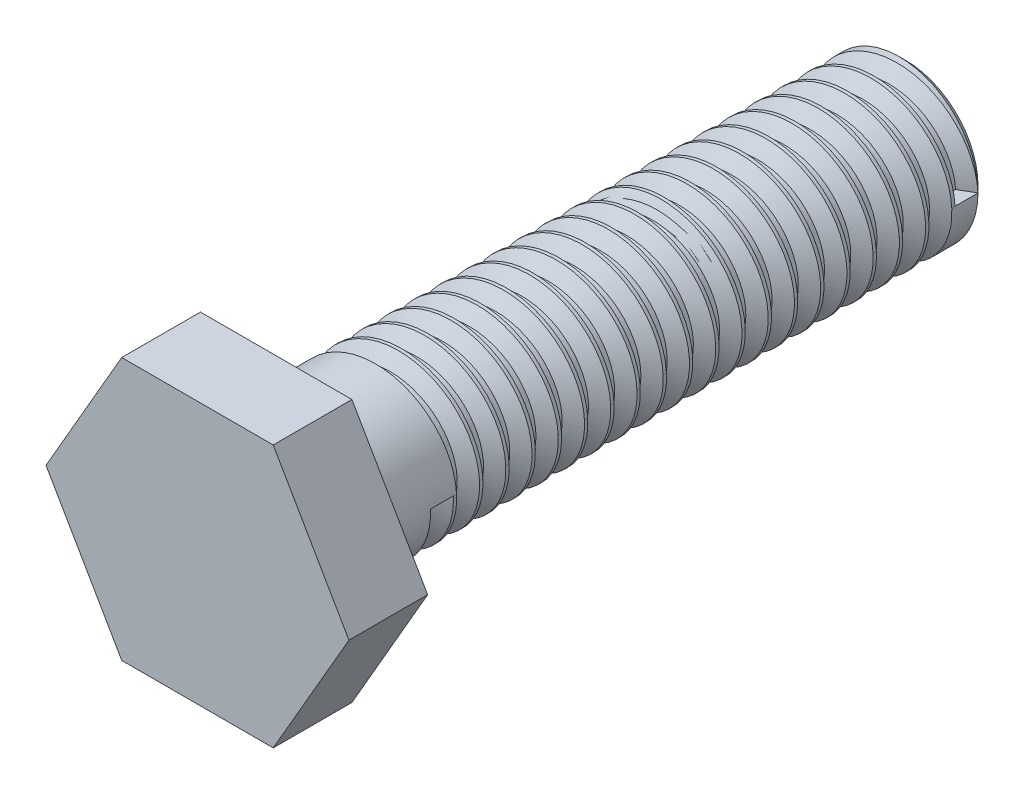
from build123d import *
from build123d.topology import SkipClean

# Parameters (mm, degrees)
EXTRUSION1_DEPTH = 5.8
SKETCH2_R        = 3
EXTRUSION2_DEPTH = 4
EXTRUSION4_DEPTH = 10
SKETCH4_R        = 3
THREAD2_DEPTH    = 20
CHAMFER2_SIZE    = 0.25
EXTRUSION6_DEPTH = 2.8
THREAD3_PITCH    = 1


with BuildPart() as part:
    # Sketch1 → Extrusion1 (new body)
    with BuildSketch(Plane.XY):
        Polygon((6.92820323, -4), (4.618802154, -8), (0, -8), (-4.618802154, -8), (-6.92820323, -4), (-9.237604307, 0), (-6.92820323, 4), (-4.618802154, 8), (0, 8), (4.618802154, 8), (6.92820323, 4), (9.237604307, 0), align=None)
    extrude(amount=-EXTRUSION1_DEPTH)

    # Sketch2 → Extrusion2 (add)
    with BuildSketch(Plane(origin=(0, 0, -5.8), x_dir=(-1, 0, 0), z_dir=(0, 0, -1))):
        Circle(SKETCH2_R)
    extrude(amount=EXTRUSION2_DEPTH)

    # Sketch3 → Extrusion4 (cut)
    with BuildSketch(Plane.XY):
        Polygon((-4.618802154, -8), (4.618802154, -8), (9.237604307, 0), (4.618802154, 8), (-4.618802154, 8), (-9.237604307, 0), align=None)
        Polygon((-2.886751346, 5), (2.886751346, 5), (5.773502692, 0), (2.886751346, -5), (-2.886751346, -5), (-5.773502692, 0), align=None, mode=Mode.SUBTRACT)
    extrude(amount=-EXTRUSION4_DEPTH, mode=Mode.SUBTRACT)

    # Sketch4 → Thread2 (add)
    with BuildSketch(Plane(origin=(0, 0, -9.8), x_dir=(-1, 0, 0), z_dir=(0, 0, -1))):
        Circle(SKETCH4_R)
    extrude(amount=THREAD2_DEPTH)

    # Chamfer2
    chamfer2_edges = [part.edges().sort_by_distance(p)[0] for p in [
        (3, 0, -29.8),
    ]]
    chamfer(chamfer2_edges, length=CHAMFER2_SIZE)

    # Sketch5 → Extrusion6 (cut)
    with BuildSketch(Plane.XY):
        Polygon((5.773502692, 0), (2.886751346, 5), (-2.886751346, 5), (-5.773502692, 0), (-2.886751346, -5), (2.886751346, -5), align=None)
    extrude(amount=-EXTRUSION6_DEPTH, mode=Mode.SUBTRACT)

    # Thread3: the profile of Thread Profile1 profile screwed along a right-hand helix of 20 turns, 8 arcs to a turn; built about Z, then put on its axis
    with SkipClean():  # the faces are left unmerged after this step: merging them gives an invalid solid
        thread3_z = Axis((0, 0, 0), (0, 0, 1))
        thread3_corners = [(3.0003, 0, -0.000173205), (3.0003, 0, 0.875173202), (2.458734125, 0, 0.562499999), (2.458734125, 0, 0.312499999)]
        with BuildLine(mode=Mode.PRIVATE) as thread3_profile:
            Line(thread3_corners[0], thread3_corners[1])
            Line(thread3_corners[1], thread3_corners[2])
            Line(thread3_corners[2], thread3_corners[3])
            Line(thread3_corners[3], thread3_corners[0])
        thread3_cap = Face(thread3_profile.wire())
        thread3_turn_angles = [0, 22.5, 45, 67.5, 90, 112.5, 135, 157.5, 180, 202.5, 225, 247.5, 270, 292.5, 315, 337.5, 360]
        thread3_turn_weights = [1, 0.9238795325112867, 1, 0.9238795325112867, 1, 0.9238795325112867, 1, 0.9238795325112867, 1, 0.9238795325112867, 1, 0.9238795325112867, 1, 0.9238795325112867, 1, 0.9238795325112867, 1]
        thread3_turn_rails = [Edge.make_bspline([Vector(p[0], p[1], 0).rotate(thread3_z, thread3_turn_angles[k]) / thread3_turn_weights[k] + Vector(0, 0, p[2] + THREAD3_PITCH * thread3_turn_angles[k] / 360) for k in range(17)], [0, 0, 0, 1, 1, 2, 2, 3, 3, 4, 4, 5, 5, 6, 6, 7, 7, 8, 8, 8], 2, thread3_turn_weights) for p in thread3_corners]
        thread3_turn_sides = [Face.make_surface_from_curves(thread3_turn_rails[p[0]], thread3_turn_rails[p[1]]) for p in [(0, 1), (1, 2), (2, 3), (3, 0)]]
        thread3 = Plane(origin=(0, 0, -29.55), x_dir=(1, 0, 0), z_dir=(0, 0, 1)) * Solid(Shell([*[p.moved(Location((0, 0, THREAD3_PITCH * i))) for i in range(20) for p in thread3_turn_sides], thread3_cap, thread3_cap.rotate(thread3_z, 7200).moved(Location((0, 0, THREAD3_PITCH * 7200 / 360)))]))
        add(thread3, mode=Mode.SUBTRACT)


solid = part.part
